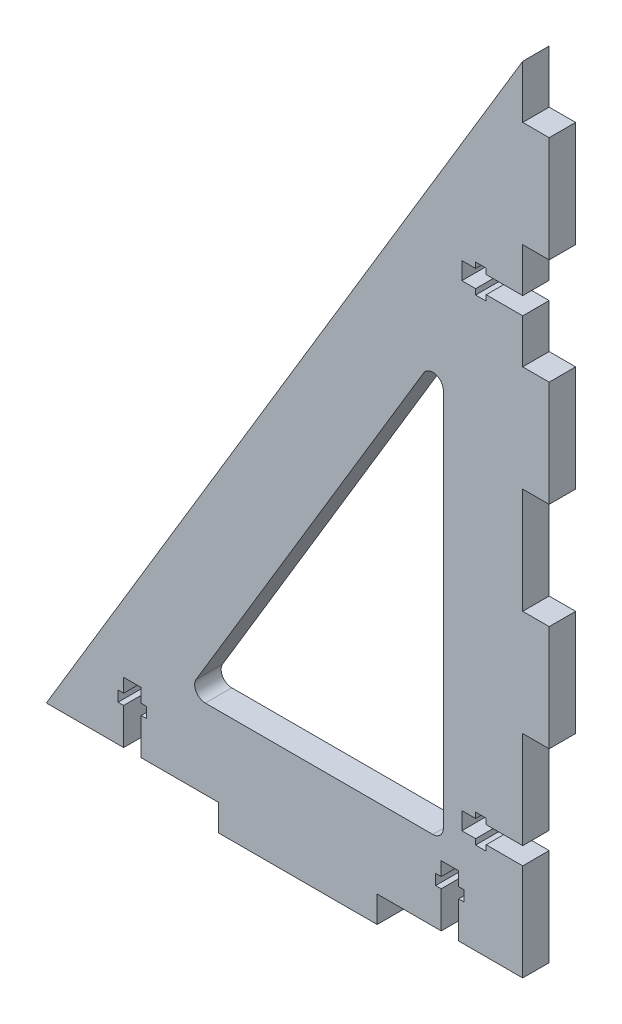
from build123d import *

# Parameters (mm, degrees)
BOSS_EXTRUDE1_DEPTH = 3.175
CUT_EXTRUDE1_DEPTH  = 223.25
SKETCH4_W           = 6.35
SKETCH4_H           = 25.4
BOSS_EXTRUDE2_DEPTH = 6.35
LPATTERN1_COUNT     = 3
LPATTERN1_PITCH     = 50.8
SKETCH5_W           = 38.1
SKETCH5_H           = 6.35
BOSS_EXTRUDE3_DEPTH = 6.35
FILLET1_R           = 2.54
CUT_EXTRUDE2_DEPTH  = 6.35


with BuildPart() as part:
    # Sketch1 → Boss-Extrude1 (new, symmetric)
    with BuildSketch(Plane.XY):
        Polygon((0, 190.5), (0, 0), (-114.3, 0), align=None)
    extrude(amount=BOSS_EXTRUDE1_DEPTH, both=True)

    # Sketch2 → Cut-Extrude1 (cut, through all)
    with BuildSketch(Plane.XY.offset(3.175)):
        Polygon((-80.654073281, 19.05), (-19.05, 19.05), (-19.05, 121.723455468), align=None)
    extrude(amount=-CUT_EXTRUDE1_DEPTH, mode=Mode.SUBTRACT)

    # Sketch4 → Boss-Extrude2 (add)
    with BuildSketch(Plane(origin=(0, 0, 0), x_dir=(0, 0, -1), z_dir=(1, 0, 0))):
        with Locations((0, 165.1)):
            Rectangle(SKETCH4_W, SKETCH4_H)
    boss_extrude2 = extrude(amount=BOSS_EXTRUDE2_DEPTH)

    # LPattern1: Boss-Extrude2 ×3
    with Locations(*[(0, -i * LPATTERN1_PITCH, 0) for i in range(1, LPATTERN1_COUNT)]):
        add(boss_extrude2)

    # Sketch5 → Boss-Extrude3 (add)
    with BuildSketch(Plane(origin=(0, 0, 0), x_dir=(-1, 0, 0), z_dir=(0, -1, 0))):
        with Locations((53.975, 0)):
            Rectangle(SKETCH5_W, SKETCH5_H)
    extrude(amount=BOSS_EXTRUDE3_DEPTH)

    # Fillet1
    fillet1_edges = [part.edges().sort_by_distance(p)[0] for p in [
        (-19.05, 121.723455468, 0),
        (-19.05, 19.05, 0),
        (-80.654073281, 19.05, 0),
    ]]
    fillet(fillet1_edges, radius=FILLET1_R)

    # Sketch3 → Cut-Extrude2 (cut)
    with BuildSketch(Plane(origin=(0, 0, -3.175), x_dir=(-1, 0, 0), z_dir=(0, 0, -1))):
        Polygon((91.567, 0), (95.758, 0), (95.758, 8.763), (97.0915, 8.763), (97.0915, 11.303), (95.758, 11.303), (95.758, 14.605), (91.567, 14.605), (91.567, 11.303), (90.2335, 11.303), (90.2335, 8.763), (91.567, 8.763), align=None)
        Polygon((15.367, 0), (19.558, 0), (19.558, 8.763), (20.8915, 8.763), (20.8915, 11.303), (19.558, 11.303), (19.558, 14.605), (15.367, 14.605), (15.367, 11.303), (14.0335, 11.303), (14.0335, 8.763), (15.367, 8.763), align=None)
        Polygon((0, 141.7955), (0, 137.6045), (8.763, 137.6045), (8.763, 136.271), (11.303, 136.271), (11.303, 137.6045), (14.605, 137.6045), (14.605, 141.7955), (11.303, 141.7955), (11.303, 143.129), (8.763, 143.129), (8.763, 141.7955), align=None)
        Polygon((0, 27.4955), (0, 23.3045), (8.763, 23.3045), (8.763, 21.971), (11.303, 21.971), (11.303, 23.3045), (14.605, 23.3045), (14.605, 27.4955), (11.303, 27.4955), (11.303, 28.829), (8.763, 28.829), (8.763, 27.4955), align=None)
    extrude(amount=-CUT_EXTRUDE2_DEPTH, mode=Mode.SUBTRACT)


solid = part.part
